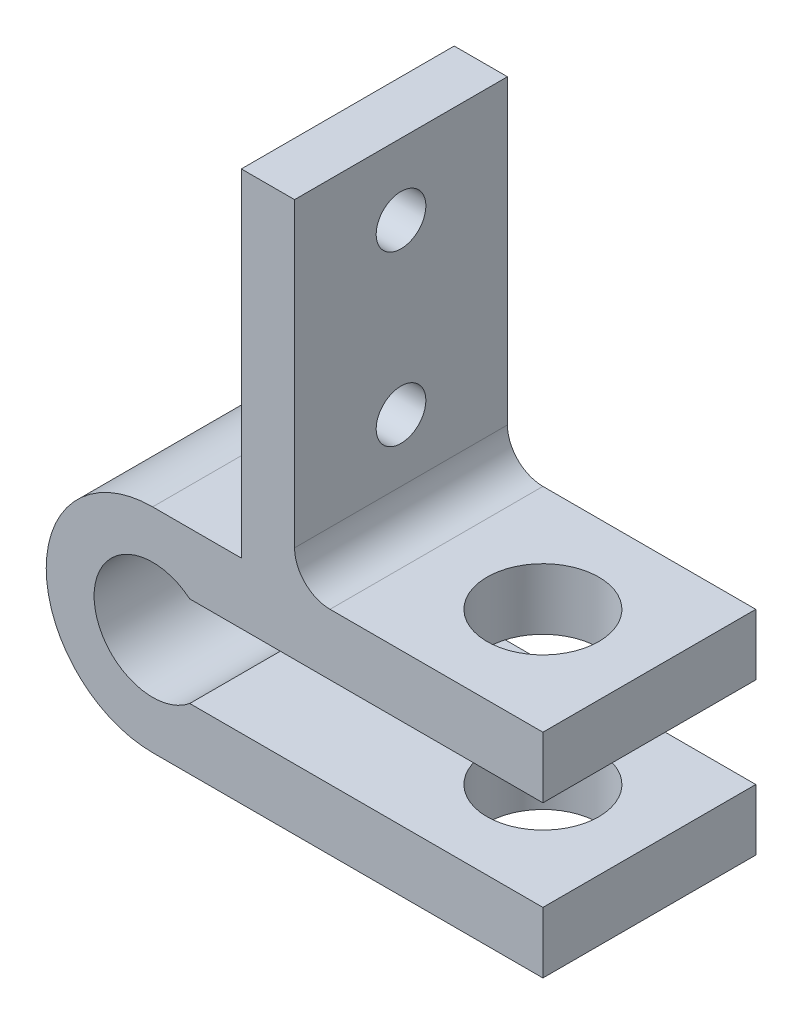
from build123d import *

# Parameters (mm, degrees)
BOSS_EXTRUDE1_DEPTH     = 12
CUT_EXTRUDE1_DEPTH      = 36.397740041
CUT_EXTRUDE1_DEPTH_BACK = 36.397740041
SKETCH2_R               = 3.15
CUT_EXTRUDE2_REACH      = 34.527
SKETCH3_R               = 1.4


with BuildPart() as part:
    # Sketch1 → Boss-Extrude1 (new body)
    with BuildSketch(Plane.XY):
        with BuildLine():
            Line((10, 6), (22, 6))
            Line((22, 6), (22, 2.552710574))
            Line((22, 2.552710574), (2.091331807, 2.552710574))
            ThreePointArc((2.091331807, 2.552710574), (-3.3, 0), (2.091331807, -2.552710574))
            Line((2.091331807, -2.552710574), (22, -2.552710574))
            Line((22, -2.552710574), (22, -6))
            Line((22, -6), (0, -6))
            ThreePointArc((0, -6), (-6, 0), (0, 6))
            Line((0, 6), (5, 6))
            Line((5, 6), (5, 25))
            Line((5, 25), (8, 25))
            Line((8, 25), (8, 8))
            ThreePointArc((8, 8), (8.585786438, 6.585786438), (10, 6))
        make_face()
    extrude(amount=BOSS_EXTRUDE1_DEPTH)

    # Sketch2 → Cut-Extrude1 (cut, two sides: drawn at the far end of the back side and taken through both)
    with BuildSketch(Plane(origin=(0, 0, 0), x_dir=(1, 0, 0), z_dir=(0, 1, 0)).offset(-CUT_EXTRUDE1_DEPTH_BACK)):
        with Locations((16, -6)):
            Circle(SKETCH2_R)
    extrude(amount=CUT_EXTRUDE1_DEPTH + CUT_EXTRUDE1_DEPTH_BACK, mode=Mode.SUBTRACT)

    # Sketch3 → Cut-Extrude2 (cut, up to next)
    with BuildSketch(Plane.ZY.offset(-5), mode=Mode.PRIVATE) as cut_extrude2_sk1:
        with Locations((6, 21)):
            Circle(SKETCH3_R)
    cut_extrude2_tool1 = extrude(cut_extrude2_sk1.sketch, amount=-CUT_EXTRUDE2_REACH, mode=Mode.PRIVATE) & part.part
    # Sketch3 → Cut-Extrude2 (cut, up to next)
    with BuildSketch(Plane.ZY.offset(-5), mode=Mode.PRIVATE) as cut_extrude2_sk2:
        with Locations((6, 11.5)):
            Circle(SKETCH3_R)
    cut_extrude2_tool2 = extrude(cut_extrude2_sk2.sketch, amount=-CUT_EXTRUDE2_REACH, mode=Mode.PRIVATE) & part.part
    add(cut_extrude2_tool1.solids().sort_by_distance((5, 21, 6))[0], mode=Mode.SUBTRACT)
    add(cut_extrude2_tool2.solids().sort_by_distance((5, 11.5, 6))[0], mode=Mode.SUBTRACT)


solid = part.part
